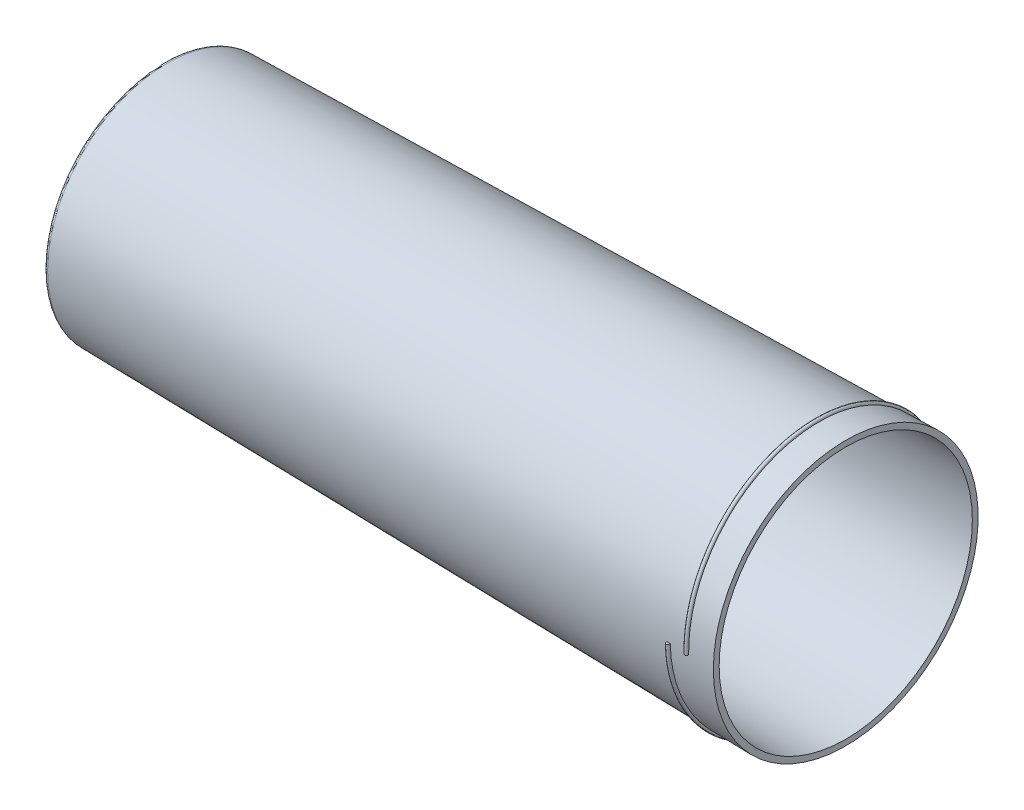
from build123d import *

# Parameters (mm, degrees)
SWEEP_1_PITCH = 0.45
FILLET_3_R    = 0.1


with BuildPart() as part:
    # 草图1 → 旋转3 (revolve)
    with BuildSketch(Plane.XY, mode=Mode.PRIVATE) as revolve_3_sk:
        with BuildLine():
            Line((-14.500599108, -0.458323283), (1.999400892, -0.158323283))
            Line((1.999400892, -0.158323283), (1.999400892, -0.298323283))
            Line((1.999400892, -0.298323283), (-14.360599108, -0.598323283))
            ThreePointArc((-14.360599108, -0.598323283), (-14.217076798, -1.974601707), (-14.203691623, -3.358278617))
            Line((-14.203691623, -3.358278617), (-14.357505029, -3.358278617))
            ThreePointArc((-14.357505029, -3.358278617), (-14.375184367, -1.905642927), (-14.500599108, -0.458323283))
        make_face()
    revolve(revolve_3_sk.sketch.rotate(Axis((-14.483691623, -3.358278617, 0), (1, 0, 0)), 90), axis=Axis((-14.483691623, -3.358278617, 0), (1, 0, 0)))

    # 扫描1: arcs per turn and ends read off the stored shape
    # 扫描1: the profile of 草图9 screwed along a right-hand helix through 1 turns, 6 arcs to a turn; built about Z, then put on its axis
    sweep_1_z = Axis((0, 0, 0), (0, 0, 1))
    sweep_1_corners = [(3.199748648, 5.52e-07, 0.407301454), (3.15682446, 0.000111601, 0.450225786), (3.199748648, 5.52e-07, 0.493150117), (3.242672835, -0.000110498, 0.450225786)]
    with BuildLine(mode=Mode.PRIVATE) as sweep_1_profile:
        ThreePointArc((3.199748648, 5.52e-07, 0.407301454), (3.169396663, 7.9075e-05, 0.4198737), (3.15682446, 0.000111601, 0.450225786))
        ThreePointArc((3.15682446, 0.000111601, 0.450225786), (3.169396663, 7.9075e-05, 0.480577871), (3.199748648, 5.52e-07, 0.493150117))
        ThreePointArc((3.199748648, 5.52e-07, 0.493150117), (3.230100632, -7.7972e-05, 0.480577871), (3.242672835, -0.000110498, 0.450225786))
        ThreePointArc((3.242672835, -0.000110498, 0.450225786), (3.230100632, -7.7972e-05, 0.4198737), (3.199748648, 5.52e-07, 0.407301454))
    sweep_1_cap = Face(sweep_1_profile.wire())
    sweep_1_arcs = [((3.199748648, 5.52e-07, 0.407301454), (3.15682446, 0.000111601, 0.407301454), (3.15682446, 0.000111601, 0.450225786), (1, 0.7071067811865475, 1)), ((3.15682446, 0.000111601, 0.450225786), (3.15682446, 0.000111601, 0.493150117), (3.199748648, 5.52e-07, 0.493150117), (1, 0.7071067811865475, 1)), ((3.199748648, 5.52e-07, 0.493150117), (3.242672835, -0.000110498, 0.493150117), (3.242672835, -0.000110498, 0.450225786), (1, 0.7071067811865475, 1)), ((3.242672835, -0.000110498, 0.450225786), (3.242672835, -0.000110498, 0.407301454), (3.199748648, 5.52e-07, 0.407301454), (1, 0.7071067811865475, 1))]  # start, shoulder, end, weights
    sweep_1_turn_angles = [0, 30, 60, 90, 120, 150, 180, 210, 240, 270, 300, 330, 360]
    sweep_1_turn_weights = [1, 0.8660254037844387, 1, 0.8660254037844387, 1, 0.8660254037844387, 1, 0.8660254037844387, 1, 0.8660254037844387, 1, 0.8660254037844387, 1]
    sweep_1_turn_sides = [Face.make_bezier_surface([[Vector(p[j][0], p[j][1], 0).rotate(sweep_1_z, sweep_1_turn_angles[2 * i + k]) / sweep_1_turn_weights[2 * i + k] + Vector(0, 0, p[j][2] + SWEEP_1_PITCH * sweep_1_turn_angles[2 * i + k] / 360) for k in range(3)] for j in range(3)], [[p[3][j] * sweep_1_turn_weights[2 * i + k] for k in range(3)] for j in range(3)]) for p in sweep_1_arcs for i in range(6)]
    sweep_1 = Plane(origin=(1.8, -3.358278617, 0), x_dir=(0, 0, 1), z_dir=(-1, 0, 0)) * Solid(Shell([*sweep_1_turn_sides, sweep_1_cap, sweep_1_cap.rotate(sweep_1_z, 360).moved(Location((0, 0, SWEEP_1_PITCH * 360 / 360)))]))
    add(sweep_1)

    # 圆角3
    fillet_3_edges = [part.edges().sort_by_distance(p)[0] for p in [
        (-14.500599108, -3.358278617, -2.899955334),
    ]]
    fillet(fillet_3_edges, radius=FILLET_3_R)


solid = part.part
